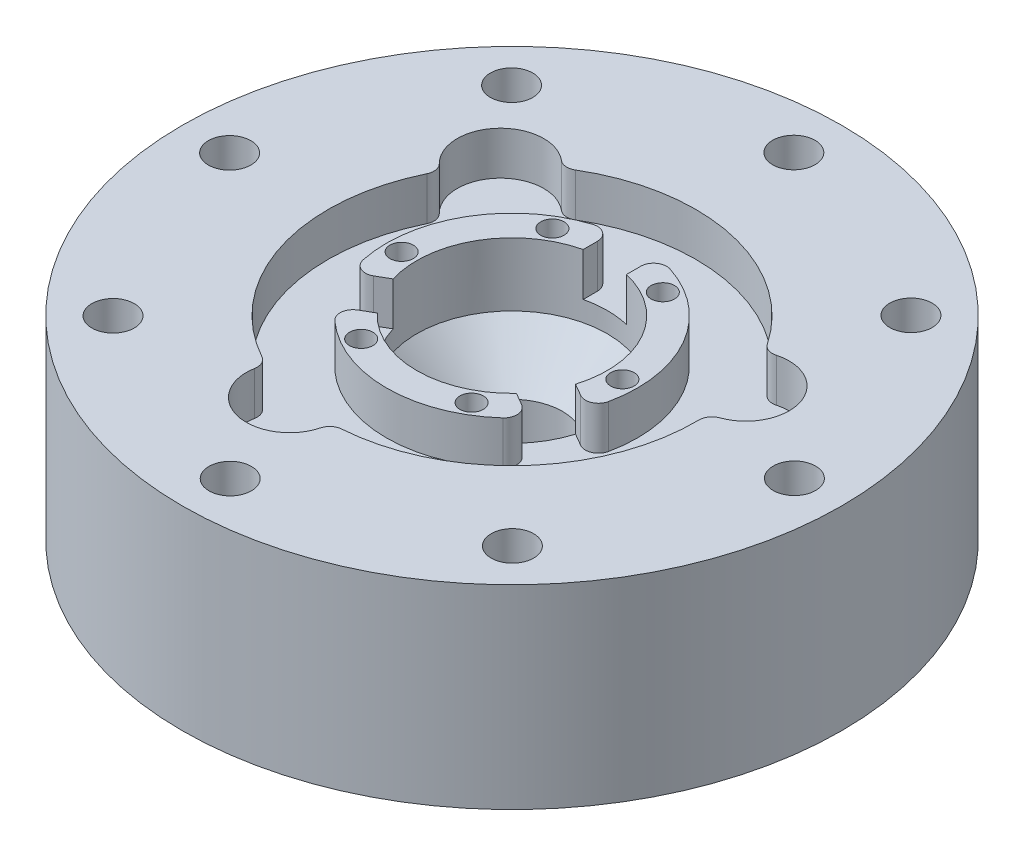
from build123d import *

# Parameters (mm, degrees)
SKETCH6_R                      = 42.5
SKETCH6_R_2                    = 29
CUT_EXTRUDE3_DEPTH             = 10
SKETCH7_W                      = 10
SKETCH7_H                      = 7.550043706
CUT_EXTRUDE4_DEPTH             = 10
CIRPATTERN2_COUNT              = 3
DELETEFACE1_START              = 15
DELETEFACE1_OUTLINE_R          = 76.2
DELETEFACE1_OUTLINE_R_2        = 55
DELETEFACE1_DEPTH              = 20
F_3_8_CLEARANCE_HOLE1_D        = 9.8044
SKETCH46_R                     = 10
CUT_EXTRUDE5_DEPTH             = 10
CIRPATTERN6_COUNT              = 3
FILLET2_R                      = 3
CIRPATTERN7_COUNT              = 6
F_1_4_0_2500_DOWEL_HOLE1_D     = 6.35
F_1_4_0_2500_DOWEL_HOLE1_DEPTH = 9.906
F_1_4_0_2500_DOWEL_HOLE1_TIP   = 1.907732465


# Read off the part's stored shape, not the designer's step: DeleteFace1
with BuildPart() as part:
    # Sketch3 → Revolve1 (revolve)
    with BuildSketch(Plane(origin=(0, 0, 0), x_dir=(0, 0, -1), z_dir=(1, 0, 0))):
        with BuildLine():
            Line((76.2, 15), (55, 15))
            Line((55, 15), (55, 35))
            Line((55, 35), (22.025, 35))
            Line((22.025, 35), (22.025, 20.36))
            Line((22.025, 20.36), (11.665, 10))
            Line((11.665, 10), (11.665, 0))
            Line((11.665, 0), (16.665, 0))
            ThreePointArc((16.665, 0), (37.471852779, 3.234070807), (53.85, -10))
            Line((53.85, -10), (76.2, -10))
            Line((76.2, -10), (76.2, 15))
        make_face()
    revolve(axis=Axis((0, 0, 0), (0, 1, 0)))

    # Sketch6 → Cut-Extrude3 (cut)
    with BuildSketch(Plane(origin=(0, 35, 0), x_dir=(1, 0, 0), z_dir=(0, 1, 0))):
        with Locations(Location((0, 0, 0), (0, 0, 270))):
            Circle(SKETCH6_R)
        with Locations(Location((0, 0, 0), (0, 0, 270))):
            Circle(SKETCH6_R_2, mode=Mode.SUBTRACT)
    extrude(amount=-CUT_EXTRUDE3_DEPTH, mode=Mode.SUBTRACT)

    # Sketch7 → Cut-Extrude4 (cut)
    with BuildSketch(Plane(origin=(0, 35, 0), x_dir=(1, 0, 0), z_dir=(0, 1, 0))):
        with Locations((0, 25.224978147)):
            Rectangle(SKETCH7_W, SKETCH7_H)
    cut_extrude4 = extrude(amount=-CUT_EXTRUDE4_DEPTH, mode=Mode.SUBTRACT)

    # CirPattern2: Cut-Extrude4 ×3 about axis
    cirpattern2_axis = Axis((0, 0, 0), (0, 1, 0))
    for i in range(1, CIRPATTERN2_COUNT):
        add(cut_extrude4.rotate(cirpattern2_axis, i * 360 / CIRPATTERN2_COUNT), mode=Mode.SUBTRACT)

    # DeleteFace1 outline → DeleteFace1 (add)
    with BuildSketch(Plane(origin=(0, 0, 0), x_dir=(1, 0, 0), z_dir=(0, 1, 0)).offset(DELETEFACE1_START)):
        Circle(DELETEFACE1_OUTLINE_R)
        Circle(DELETEFACE1_OUTLINE_R_2, mode=Mode.SUBTRACT)
    extrude(amount=DELETEFACE1_DEPTH)

    # 3/8 Clearance Hole1 (through all)
    with Locations(Plane(origin=(0, -10, 0), x_dir=(-1, 0, 0), z_dir=(0, -1, 0))):
        with Locations((46.153593538, 46.060907757), (65.203960939, -0.061814491), (46.060915247, -46.146148146), (-0.061807016, -65.196515566), (-46.146140681, -46.053469867), (-65.196508083, 0.069252405), (-46.053462365, 46.15358606), (0.069259897, 65.203953456)):
            Hole(F_3_8_CLEARANCE_HOLE1_D / 2)

    # Sketch46 → Cut-Extrude5 (cut)
    with BuildSketch(Plane(origin=(0, 35, 0), x_dir=(1, 0, 0), z_dir=(0, 1, 0))):
        with Locations((41.099239846, 12.958540547)):
            Circle(SKETCH46_R)
    cut_extrude5 = extrude(amount=-CUT_EXTRUDE5_DEPTH, mode=Mode.SUBTRACT)

    # CirPattern6: Cut-Extrude5 ×3 about axis
    cirpattern6_axis = Axis((0, 0, 0), (0, 1, 0))
    for i in range(1, CIRPATTERN6_COUNT):
        add(cut_extrude5.rotate(cirpattern6_axis, i * 360 / CIRPATTERN6_COUNT), mode=Mode.SUBTRACT)

    # Fillet2
    fillet2_edges = [part.edges().sort_by_distance(p)[0] for p in [
        (36.469652208, 30, -21.822338734),
        (42.390969445, 30, -3.042319763),
        (-37.133525818, 30, -20.672475912),
        (-23.830210924, 30, -35.190496549),
        (0.66387361, 30, 42.494814646),
        (-18.560758521, 30, 38.232816312),
        (5, 30, -28.565713714),
        (-5, 30, -28.565713714),
        (27.238633754, 30, 9.952729838),
        (22.238633754, 30, 18.612983876),
        (-22.238633754, 30, 18.612983876),
        (-27.238633754, 30, 9.952729838),
    ]]
    fillet(fillet2_edges, radius=FILLET2_R)

    # Sketch51 → 1/4-28 Tapped Hole1 (revolve, cut)
    with BuildSketch(Plane(origin=(25.5125, 35, 0), x_dir=(0, 0, 1), z_dir=(1, 0, 0))):
        Polygon((0, 0), (0, 17.045388061), (2.7051, 15.42), (2.7051, 0), align=None)
    f_1_4_28_tapped_hole1 = revolve(axis=Axis((25.5125, 41.35, 0), (0, -1, 0)), mode=Mode.SUBTRACT)

    # CirPattern7: 1/4-28 Tapped Hole1 ×6 about axis
    cirpattern7_axis = Axis((0, 0, 0), (0, 1, 0))
    for i in range(1, CIRPATTERN7_COUNT):
        add(f_1_4_28_tapped_hole1.rotate(cirpattern7_axis, i * 360 / CIRPATTERN7_COUNT), mode=Mode.SUBTRACT)

    # 1/4 (0.2500) Dowel Hole1
    with Locations(Plane(origin=(0, -10, 0), x_dir=(-1, 0, 0), z_dir=(0, -1, 0))):
        with Locations((-25.007850676, -60.207814752), (25.01513322, 60.21585851)):
            Hole(F_1_4_0_2500_DOWEL_HOLE1_D / 2, depth=F_1_4_0_2500_DOWEL_HOLE1_DEPTH)
            with Locations((0, 0, -(F_1_4_0_2500_DOWEL_HOLE1_DEPTH + F_1_4_0_2500_DOWEL_HOLE1_TIP / 2))):  # 118° drill point
                Cone(0, F_1_4_0_2500_DOWEL_HOLE1_D / 2, F_1_4_0_2500_DOWEL_HOLE1_TIP, mode=Mode.SUBTRACT)


solid = part.part
